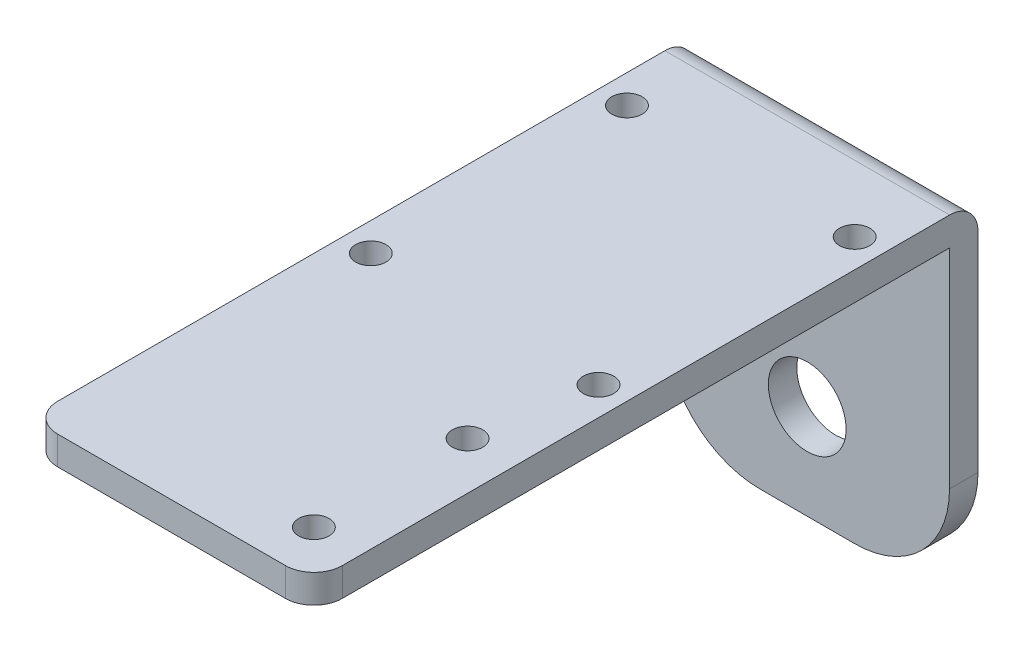
from build123d import *

# Parameters (mm, degrees)
SKETCH_1_W          = 30
SKETCH_1_H          = 70
SKETCH_1_R          = 1.6
EXTRUDE_1_DEPTH     = 3
SKETCH_2_W          = 30
SKETCH_2_H          = 3
EXTRUDE_2_DEPTH     = 32
CUT_EXTRUDE_1_REACH = 80.416
SKETCH_3_R          = 4.1
FILLET_1_R          = 3
FILLET_2_R          = 10


with BuildPart() as part:
    # 草图1 → 凸台-拉伸1 (new body)
    with BuildSketch(Plane(origin=(0, 0, 0), x_dir=(1, 0, 0), z_dir=(0, 1, 0))):
        Rectangle(SKETCH_1_W, SKETCH_1_H)
        with Locations((-12, 25)):
            Circle(SKETCH_1_R, mode=Mode.SUBTRACT)
        with Locations((12, 25)):
            Circle(SKETCH_1_R, mode=Mode.SUBTRACT)
        with Locations((12, -2)):
            Circle(SKETCH_1_R, mode=Mode.SUBTRACT)
        with Locations((-12, -2)):
            Circle(SKETCH_1_R, mode=Mode.SUBTRACT)
        with Locations((10, -30)):
            Circle(SKETCH_1_R, mode=Mode.SUBTRACT)
        with Locations((10, -13.8)):
            Circle(SKETCH_1_R, mode=Mode.SUBTRACT)
    extrude(amount=EXTRUDE_1_DEPTH)

    # 草图2 → 凸台-拉伸2 (add)
    with BuildSketch(Plane.XZ):
        with Locations((0, -33.5)):
            Rectangle(SKETCH_2_W, SKETCH_2_H)
    extrude(amount=EXTRUDE_2_DEPTH)

    # 草图3 → 切除-拉伸1 (cut, up to next)
    with BuildSketch(Plane(origin=(0, 0, -35), x_dir=(-1, 0, 0), z_dir=(0, 0, -1)), mode=Mode.PRIVATE) as cut_extrude_1_sk1:
        with Locations((0, -22)):
            Circle(SKETCH_3_R)
    cut_extrude_1_tool1 = extrude(cut_extrude_1_sk1.sketch, amount=-CUT_EXTRUDE_1_REACH, mode=Mode.PRIVATE) & part.part
    add(cut_extrude_1_tool1.solids().sort_by_distance((0, -22, -35))[0], mode=Mode.SUBTRACT)

    # 圆角1
    fillet_1_edges = [part.edges().sort_by_distance(p)[0] for p in [
        (-15, 1.5, 35),
        (15, 1.5, 35),
        (0, 3, -35),
    ]]
    fillet(fillet_1_edges, radius=FILLET_1_R)

    # 圆角2
    fillet_2_edges = [part.edges().sort_by_distance(p)[0] for p in [
        (-15, -32, -33.5),
        (15, -32, -33.5),
    ]]
    fillet(fillet_2_edges, radius=FILLET_2_R)


solid = part.part
